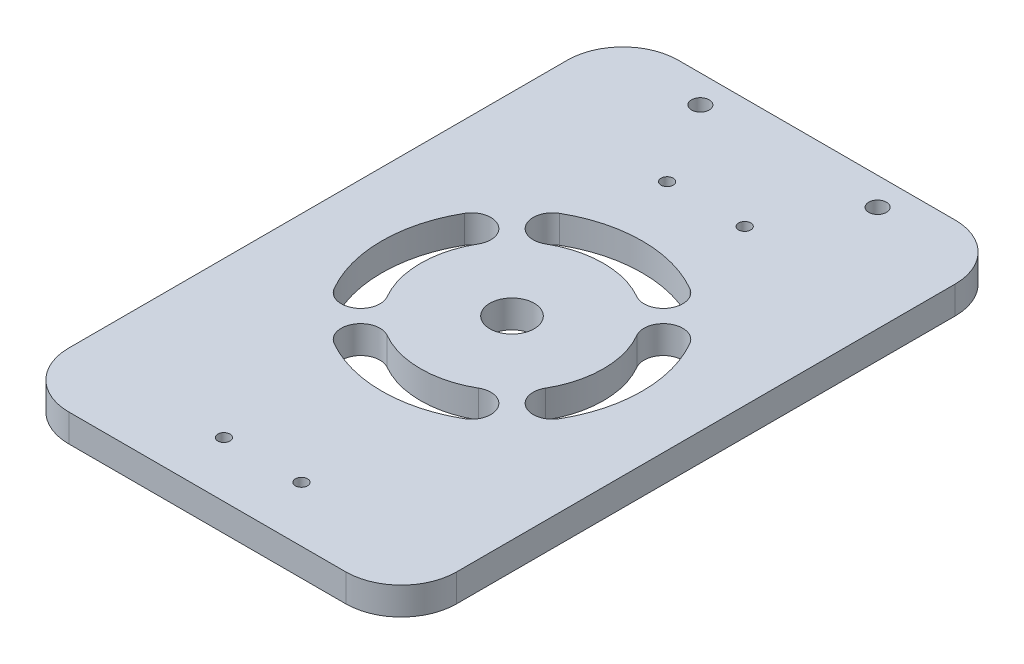
from build123d import *

# Parameters (mm, degrees)
SKETCH_1_W          = 70
SKETCH_1_H          = 110
SKETCH_1_R          = 1.6
SKETCH_1_R_2        = 1.1
EXTRUDE_1_DEPTH     = 5
FILLET_1_R          = 10
SKETCH_3_R          = 4
CUT_EXTRUDE_2_DEPTH = 5


with BuildPart() as part:
    # 草图1 → 凸台-拉伸1 (new body)
    with BuildSketch(Plane(origin=(0, 0, 0), x_dir=(1, 0, 0), z_dir=(0, 1, 0))):
        Rectangle(SKETCH_1_W, SKETCH_1_H)
        with Locations((-16, 50)):
            Circle(SKETCH_1_R, mode=Mode.SUBTRACT)
        with Locations((-7, 35)):
            Circle(SKETCH_1_R_2, mode=Mode.SUBTRACT)
        with Locations((-7, -45)):
            Circle(SKETCH_1_R_2, mode=Mode.SUBTRACT)
        with Locations((7, -45)):
            Circle(SKETCH_1_R_2, mode=Mode.SUBTRACT)
        with Locations((7, 35)):
            Circle(SKETCH_1_R_2, mode=Mode.SUBTRACT)
        with Locations((16, 50)):
            Circle(SKETCH_1_R, mode=Mode.SUBTRACT)
    extrude(amount=EXTRUDE_1_DEPTH)

    # 圆角1
    fillet_1_edges = [part.edges().sort_by_distance(p)[0] for p in [
        (-35, 2.5, 55),
        (35, 2.5, 55),
        (35, 2.5, -55),
        (-35, 2.5, -55),
    ]]
    fillet(fillet_1_edges, radius=FILLET_1_R)

    # 草图3 → 切除-拉伸2 (cut)
    with BuildSketch(Plane(origin=(0, 0, 0), x_dir=(1, 0, 0), z_dir=(0, 1, 0))):
        Circle(SKETCH_3_R)
        with BuildLine():
            ThreePointArc((-20.351596989, 11.75), (-23.5, 0), (-20.351596989, -11.75))
            ThreePointArc((-20.351596989, -11.75), (-15.570508076, -13.031088913), (-14.289419162, -8.25))
            ThreePointArc((-14.289419162, -8.25), (-16.5, 0), (-14.289419162, 8.25))
            ThreePointArc((-14.289419162, 8.25), (-15.570508076, 13.031088913), (-20.351596989, 11.75))
        make_face()
        with BuildLine():
            ThreePointArc((11.75, 20.351596989), (0, 23.5), (-11.75, 20.351596989))
            ThreePointArc((-11.75, 20.351596989), (-13.031088913, 15.570508076), (-8.25, 14.289419162))
            ThreePointArc((-8.25, 14.289419162), (0, 16.5), (8.25, 14.289419162))
            ThreePointArc((8.25, 14.289419162), (13.031088913, 15.570508076), (11.75, 20.351596989))
        make_face()
        with BuildLine():
            ThreePointArc((20.351596989, -11.75), (23.5, 0), (20.351596989, 11.75))
            ThreePointArc((20.351596989, 11.75), (15.570508076, 13.031088913), (14.289419162, 8.25))
            ThreePointArc((14.289419162, 8.25), (16.5, 0), (14.289419162, -8.25))
            ThreePointArc((14.289419162, -8.25), (15.570508076, -13.031088913), (20.351596989, -11.75))
        make_face()
        with BuildLine():
            ThreePointArc((-11.75, -20.351596989), (0, -23.5), (11.75, -20.351596989))
            ThreePointArc((11.75, -20.351596989), (13.031088913, -15.570508076), (8.25, -14.289419162))
            ThreePointArc((8.25, -14.289419162), (0, -16.5), (-8.25, -14.289419162))
            ThreePointArc((-8.25, -14.289419162), (-13.031088913, -15.570508076), (-11.75, -20.351596989))
        make_face()
    extrude(amount=CUT_EXTRUDE_2_DEPTH, mode=Mode.SUBTRACT)


solid = part.part
